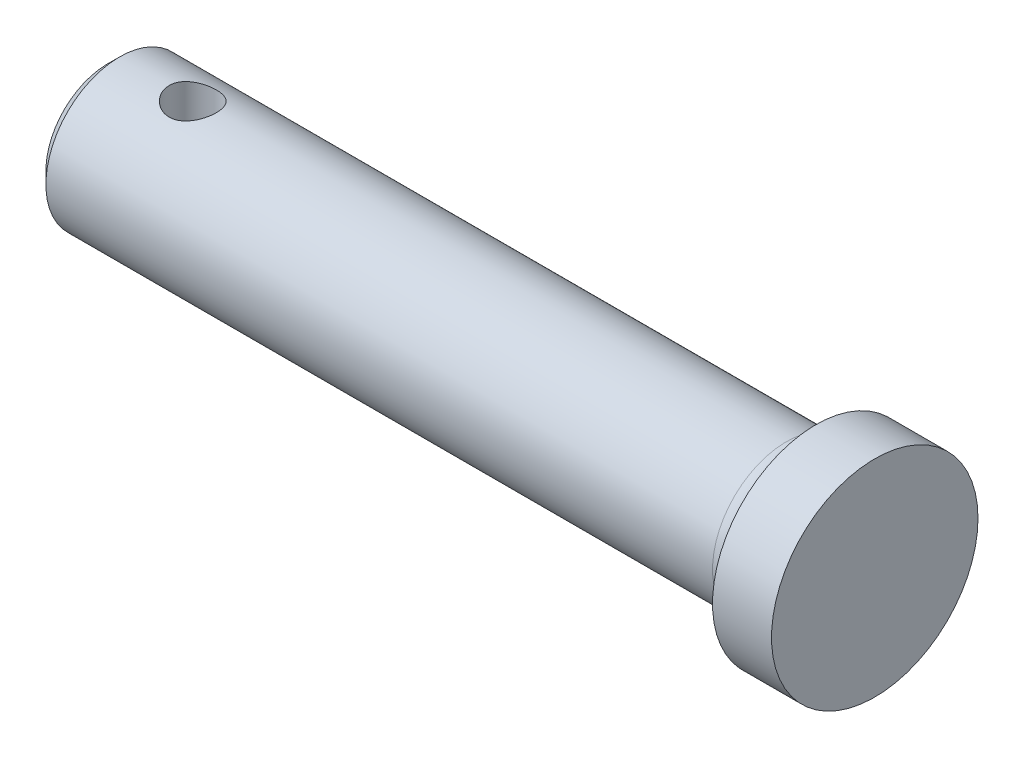
from build123d import *

# Parameters (mm, degrees)
SKETCH1_R               = 1.25
BOSS_EXTRUDE1_DEPTH     = 12
SKETCH2_R               = 1.75
BOSS_EXTRUDE2_DEPTH     = 1
FILLET1_R               = 0.5
CUT_EXTRUDE1_DEPTH      = 14.233480268
CUT_EXTRUDE1_DEPTH_BACK = 14.233480268
SKETCH3_R               = 0.4
CHAMFER1_SIZE           = 0.2


with BuildPart() as part:
    # Sketch1 → Boss-Extrude1 (new body)
    with BuildSketch(Plane(origin=(0, 0, 0), x_dir=(0, 0, -1), z_dir=(1, 0, 0))):
        Circle(SKETCH1_R)
    extrude(amount=BOSS_EXTRUDE1_DEPTH)

    # Sketch2 → Boss-Extrude2 (add)
    with BuildSketch(Plane(origin=(12, 0, 0), x_dir=(0, 0, -1), z_dir=(1, 0, 0))):
        Circle(SKETCH2_R)
    extrude(amount=BOSS_EXTRUDE2_DEPTH)

    # Fillet1
    fillet1_edges = [part.edges().sort_by_distance(p)[0] for p in [
        (12, 0, 1.25),
    ]]
    fillet(fillet1_edges, radius=FILLET1_R - 0.0001)  # a hair under: the kernel refuses the full size

    # Sketch3 → Cut-Extrude1 (cut, two sides: drawn at the far end of the back side and taken through both)
    with BuildSketch(Plane(origin=(0, 0, 0), x_dir=(1, 0, 0), z_dir=(0, 1, 0)).offset(-CUT_EXTRUDE1_DEPTH_BACK)):
        with Locations(Location((1.44, 0, 0), (0, 0, 270))):
            Circle(SKETCH3_R)
    extrude(amount=CUT_EXTRUDE1_DEPTH + CUT_EXTRUDE1_DEPTH_BACK, mode=Mode.SUBTRACT)

    # Chamfer1
    chamfer1_edges = [part.edges().sort_by_distance(p)[0] for p in [
        (0, 0, 1.25),
    ]]
    chamfer(chamfer1_edges, length=CHAMFER1_SIZE)


solid = part.part
